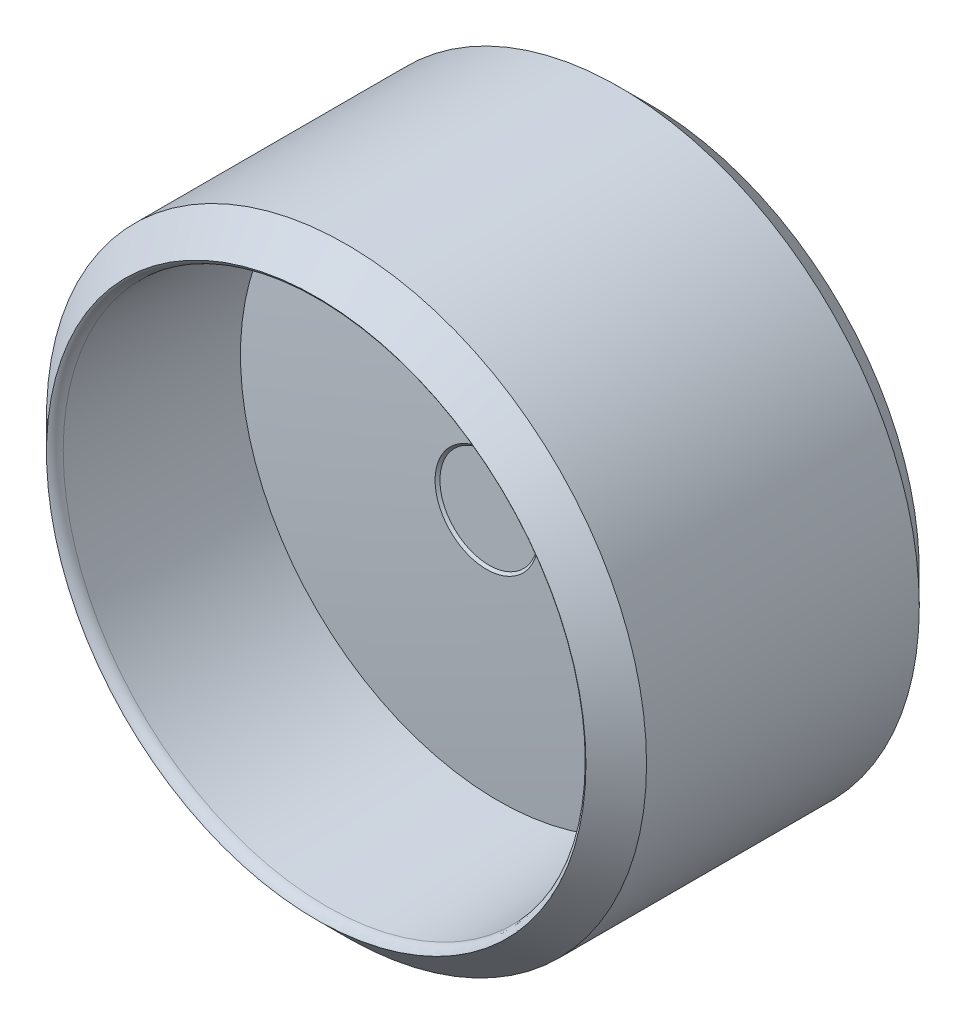
from build123d import *

# Parameters (mm, degrees)
CHAMFER_1_SIZE      = 1
FILLET_1_R          = 0.4
SKETCH_2_R          = 1.5
CUT_EXTRUDE_1_DEPTH = 6.7
CHAMFER_2_SIZE      = 0.2
CHAMFER_2_SIZE_2    = 0.196243157


with BuildPart() as part:
    # 스케치1 → 회전1 (revolve)
    with BuildSketch(Plane(origin=(0, 0, 0), x_dir=(1, 0, 0), z_dir=(0, 1, 0))):
        with BuildLine():
            Line((0, 0), (4, 0))
            Line((4, 0), (5.894700278586023, 2))
            Line((5.894700278586023, 2), (9.9, 2))
            Line((9.9, 2), (9.900000000000002, -9))
            Line((9.900000000000002, -9), (8.700000000000008, -9))
            Line((8.700000000000008, -9), (8.5, -2.999999999999999))
            ThreePointArc((8.5, -2.999999999999999), (4.254277259758997, -3.290891769878769), (0, -3.4000000000000004))
            Line((0, -3.4000000000000004), (0, -3))
            Line((0, -3), (0, 0))
        make_face()
    revolve(axis=Axis((0, 0, 3), (0, 0, -1)))

    # 모따기1
    chamfer_1_edges = [part.edges().sort_by_distance(p)[0] for p in [
        (-9.900000000000002, -1.21e-15, 9),
        (-9.9, -1.21e-15, -2),
    ]]
    chamfer(chamfer_1_edges, length=CHAMFER_1_SIZE)

    # 필렛1
    # the kernel refuses this fillet: 0.4 mm, written as the material it takes off along each edge
    with BuildSketch(Plane(origin=(0, 0, 9), x_dir=(1, 0, 0), z_dir=(0, 1, 0))) as fillet_1_piece_1:
        with BuildLine():
            CenterArc((9.088461478811075, 0.35282045151089214), FILLET_1_R, 181.90915243299636, 59.981635971248124)
            Line((8.688683516019413, 0.3394945194178369), (8.68068795676358, 0.33922800077597515))
            Line((8.68068795676358, 0.33922800077597515), (8.692004440744174, -0.00026651864186178))
            Line((8.692004440744174, -0.00026651864186178), (8.700000000000008, -0.00799999999999912))
            ThreePointArc((8.700000000000008, -0.00799999999999912), (8.800000000000006, -0.00799999999999912), (8.896230770423783, -0.00705640903021099))
            Line((8.896230770423783, -0.00705640903021099), (8.900000000000004, 7.11e-15))
        make_face()
    revolve(axis=Axis((0, 0, 9), (0, 0, -1)), mode=Mode.SUBTRACT)
    with BuildSketch(Plane(origin=(0, 0, -2), x_dir=(1, 0, 0), z_dir=(0, 1, 0))) as fillet_1_piece_2:
        with BuildLine():
            CenterArc((5.894700278586023 + FILLET_1_R * 0.430137532673, -FILLET_1_R), FILLET_1_R, 90, 46.54870972712371)
            Line((5.894700278586023 - FILLET_1_R * 0.295821777418, -FILLET_1_R * 0.312262346464), (5.894700278586023 - FILLET_1_R * 0.31034096362, -FILLET_1_R * 0.298507593393))
            Line((5.894700278586023 - FILLET_1_R * 0.31034096362, -FILLET_1_R * 0.298507593393), (5.894700278586023 - FILLET_1_R * 0.00860275065346, FILLET_1_R * 0.02))
            Line((5.894700278586023 - FILLET_1_R * 0.00860275065346, FILLET_1_R * 0.02), (5.894700278586023 + FILLET_1_R * 0.430137532673, FILLET_1_R * 0.02))
            Line((5.894700278586023 + FILLET_1_R * 0.430137532673, FILLET_1_R * 0.02), (5.894700278586023 + FILLET_1_R * 0.430137532673, 0))
        make_face()
    revolve(axis=Axis((0, 0, -2), (0, 0, -1)), mode=Mode.SUBTRACT)

    # 스케치2 → 컷-돌출1 (cut)
    with BuildSketch(Plane.XY.offset(10)):
        Circle(SKETCH_2_R)
    extrude(amount=-CUT_EXTRUDE_1_DEPTH, mode=Mode.SUBTRACT)

    # 모따기2
    # the kernel refuses this chamfer: 0.2, 0.196243157 mm, written as the material it takes off along each edge
    with BuildSketch(Plane(origin=(6.4671513e-10, -1.09559634e-09, 3.3823067338827144), x_dir=(1.0, 7.303978568468729e-10, 0), z_dir=(7.303978568468729e-10, -1.0, 0))) as chamfer_2_piece_1_section:
        with BuildLine():
            Line((1.4999999993532855 + CHAMFER_2_SIZE * 0.999793216119, -CHAMFER_2_SIZE * 0.0203353141858), (1.4999999993532855 + CHAMFER_2_SIZE_2 * 6.59095382194e-09, -CHAMFER_2_SIZE_2 * 1.00000000151))
            Line((1.4999999993532855 + CHAMFER_2_SIZE_2 * 6.59095382194e-09, -CHAMFER_2_SIZE_2 * 1.00000000151), (1.4999999993532855, 0))
            ThreePointArc((1.4999999993532855, 0), (1.6028067115105318, -0.00204082683161744), (1.4999999993532855 + CHAMFER_2_SIZE * 0.999793216119, -CHAMFER_2_SIZE * 0.0203353141858))
        make_face()
    chamfer_2_piece_1 = revolve(axis=Axis((6.4671513e-10, -1.09559634e-09, 3.3823067338827144), (0, 0, 1)), mode=Mode.PRIVATE)
    chamfer_2_piece_1 = split(chamfer_2_piece_1, bisect_by=Plane(origin=(6.4671513e-10, -1.09559634e-09, 3.3), z_dir=(0, 0, 1)), keep=Keep.TOP, mode=Mode.PRIVATE)
    add(chamfer_2_piece_1, mode=Mode.SUBTRACT)


solid = part.part
